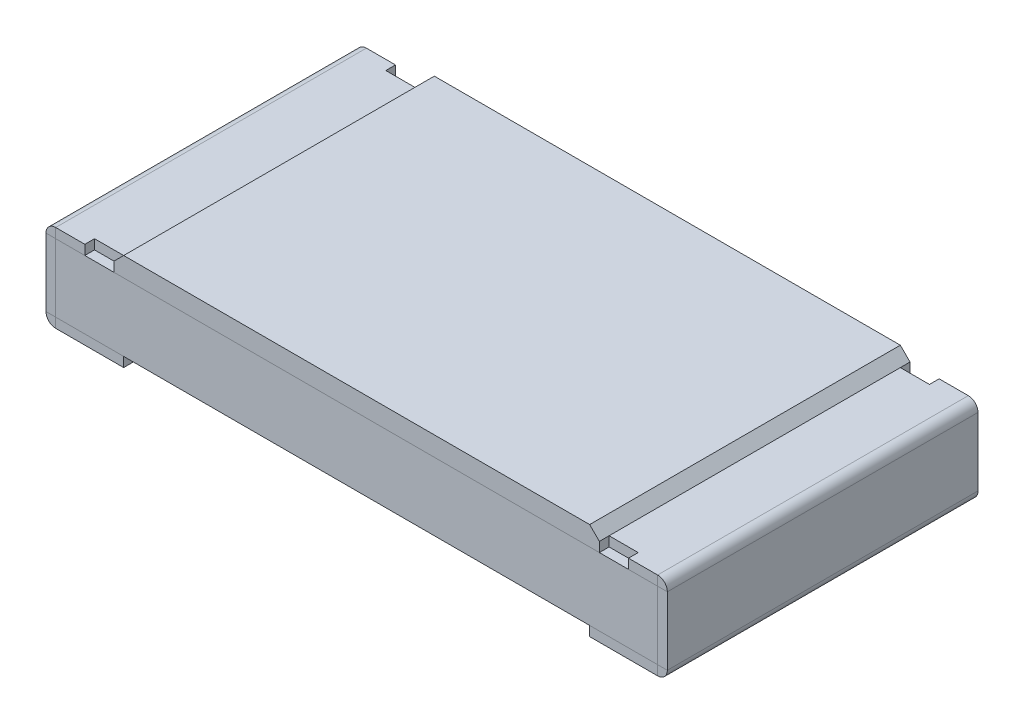
from build123d import *

# Parameters (mm, degrees)
SKETCH1_W              = 3.1
SKETCH1_H              = 1.6
BOSS_EXTRUDE1_DEPTH    = 0.35
SKETCH2_W              = 0.35
SKETCH2_H              = 1.6
BASE_FLANGE1_DEPTH     = 0.05
SM_START               = -0.8
SM_EDGE_FLANGE_1_DEPTH = 1.6
SM_EDGE_FLANGE_2_DEPTH = 1.6
SKETCH14_W             = 0.15
SKETCH14_H             = 0.05
CUT_EXTRUDE1_DEPTH     = 0.05
SKETCH17_W             = 2.5
SKETCH17_H             = 1.6
BOSS_EXTRUDE3_DEPTH    = 0.1
CHAMFER1_SIZE          = 0.05


# Read off the part's stored shape, not the designer's step: Ребро-кромка1, Ребро-кромка2
# Sheet-metal steps are written as plain solids
with BuildPart() as part:
    # Sketch1 → Boss-Extrude1 (new body)
    with BuildSketch(Plane(origin=(0, 0.05, 0), x_dir=(1, 0, 0), z_dir=(0, 1, 0))):
        Rectangle(SKETCH1_W, SKETCH1_H)
    extrude(amount=BOSS_EXTRUDE1_DEPTH)


with BuildPart() as body_2:
    # Sketch2 → Base-Flange1 (new body)
    with BuildSketch(Plane(origin=(0, 0.05, 0), x_dir=(1, 0, 0), z_dir=(0, 1, 0))):
        with Locations((1.375, 0)):
            Rectangle(SKETCH2_W, SKETCH2_H)
    extrude(amount=-BASE_FLANGE1_DEPTH)

    # Ребро-кромка1 outline → Ребро-кромка1 (add)
    with BuildSketch(Plane.XY.offset(SM_START)):
        with BuildLine():
            Line((1.55, 0.4), (1.55, 0))
            ThreePointArc((1.55, 0), (1.585355339, 0.014644661), (1.6, 0.05))
            Line((1.6, 0.05), (1.6, 0.4))
            Line((1.6, 0.4), (1.55, 0.4))
        make_face()
    extrude(amount=SM_EDGE_FLANGE_1_DEPTH)

    # Ребро-кромка2 outline → Ребро-кромка2 (add)
    with BuildSketch(Plane.XY.offset(SM_START)):
        with BuildLine():
            Line((1.25, 0.4), (1.6, 0.4))
            ThreePointArc((1.6, 0.4), (1.585355339, 0.435355339), (1.55, 0.45))
            Line((1.55, 0.45), (1.25, 0.45))
            Line((1.25, 0.45), (1.25, 0.4))
        make_face()
    extrude(amount=SM_EDGE_FLANGE_2_DEPTH)

    # Sketch14 → Cut-Extrude1 (cut)
    with BuildSketch(Plane(origin=(0, 0.45, 0), x_dir=(1, 0, 0), z_dir=(0, 1, 0))):
        with Locations((1.325, -0.775)):
            Rectangle(SKETCH14_W, SKETCH14_H)
        with Locations((1.325, 0.775)):
            Rectangle(SKETCH14_W, SKETCH14_H)
    extrude(amount=-CUT_EXTRUDE1_DEPTH, mode=Mode.SUBTRACT)


with BuildPart() as body_3:
    # Mirror1: mirrored copy
    add(body_2.part.mirror(Plane(origin=(0, 0, 0), x_dir=(0, 0, 1), z_dir=(1, 0, 0))))


with BuildPart() as body_4:
    # Sketch17 → Boss-Extrude3 (new body)
    with BuildSketch(Plane(origin=(0, 0.4, 0), x_dir=(1, 0, 0), z_dir=(0, 1, 0))):
        Rectangle(SKETCH17_W, SKETCH17_H)
    extrude(amount=BOSS_EXTRUDE3_DEPTH)

    # Chamfer1
    chamfer1_edges = [body_4.edges().sort_by_distance(p)[0] for p in [
        (-1.25, 0.5, 0),
        (1.25, 0.5, 0),
    ]]
    chamfer(chamfer1_edges, length=CHAMFER1_SIZE)


solid = Compound([part.part, body_2.part, body_3.part, body_4.part])
